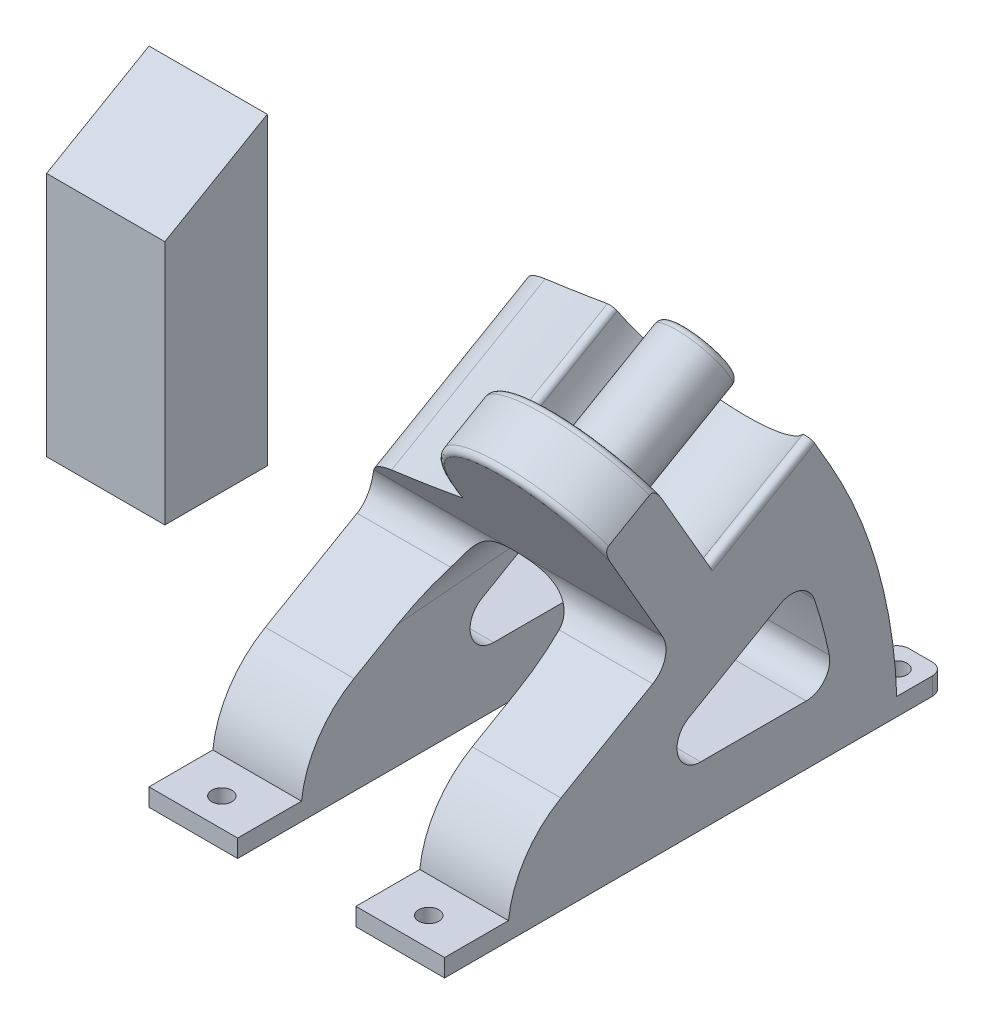
from build123d import *
from build123d.topology import SkipClean

# Parameters (mm, degrees)
AUFSATZ_LINEAR_AUSTRAGEN1_DEPTH   = 20
AUFSATZ_LINEAR_AUSTRAGEN2_DEPTH   = 30
AUFSATZ_LINEAR_AUSTRAGEN2_2_DEPTH = 30
AUFSATZ_LINEAR_AUSTRAGEN3_DEPTH   = 50
SCHNITT_LINEAR_AUSTRAGEN1_DEPTH   = 153.950505813
AUFSATZ_LINEAR_AUSTRAGEN5_DEPTH   = 50
SKIZZE12_W                        = 20
SKIZZE12_H                        = 35
SCHNITT_LINEAR_AUSTRAGEN4_DEPTH   = 155.203355684
VERRUNDUNG5_R                     = 10
VERRUNDUNG6_R                     = 10
SKIZZE13_R                        = 1.7
AUFSATZ_LINEAR_AUSTRAGEN9_DEPTH   = 3
VERRUNDUNG7_R                     = 2
SKIZZE14_W                        = 15
SKIZZE14_H                        = 19.74
SCHNITT_LINEAR_AUSTRAGEN5_DEPTH   = 145.895379972
VERRUNDUNG9_R                     = 18
SKIZZE30_W                        = 15
SKIZZE30_H                        = 5
AUFSATZ_LINEAR_AUSTRAGEN15_DEPTH  = 3
SKIZZE15_R                        = 1.7
SCHNITT_LINEAR_AUSTRAGEN6_DEPTH   = 145.895379972
SKIZZE18_W                        = 120
SKIZZE18_H                        = 10.2
SCHNITT_LINEAR_AUSTRAGEN8_DEPTH   = 10
VERRUNDUNG12_R                    = 18
VERRUNDUNG13_R                    = 2
SKIZZE16_R                        = 102.012355423
SCHNITT_LINEAR_AUSTRAGEN7_DEPTH   = 179.296805026
SKIZZE22_R                        = 1.5
SCHNITT_LINEAR_AUSTRAGEN13_DEPTH  = 10
SCHNITT_LINEAR_AUSTRAGEN14_DEPTH  = 20
AUFSATZ_LINEAR_AUSTRAGEN13_DEPTH  = 10
SKIZZE26_R                        = 5.9
AUFSATZ_LINEAR_AUSTRAGEN14_DEPTH  = 20
VERRUNDUNG14_R                    = 4.5
VERRUNDUNG15_R                    = 1
SCHNITT_LINEAR_AUSTRAGEN15_DEPTH  = 144.666423876
VERRUNDUNG16_R                    = 4
VERRUNDUNG17_R                    = 8.8
VERRUNDUNG18_R                    = 1
VERRUNDUNG19_R                    = 1
VERRUNDUNG20_R                    = 2
SCHNITT_LINEAR_AUSTRAGEN16_DEPTH  = 10


# Some blends are built 0.0001 mm under size
with BuildPart() as part:
    # Skizze1 → Aufsatz-Linear austragen1 (new body)
    with BuildSketch(Plane(origin=(0, 0, 0), x_dir=(0, 0, -1), z_dir=(1, 0, 0))):
        Polygon((0, 0), (0, 51.5), (-17.320508076, 41.5), (-17.320508076, 0), align=None)
    extrude(amount=AUFSATZ_LINEAR_AUSTRAGEN1_DEPTH)


with BuildPart() as body_2:
    # Skizze2 → Aufsatz-Linear austragen2 (new body)
    with BuildSketch(Plane(origin=(0, 12.875, -22.300154147), x_dir=(-1, 0, 0), z_dir=(0, 0.49999999999999506, -0.8660254037844415))):
        with BuildLine():
            Line((90, 62.898373783), (90, 34.475308295))
            Line((90, 34.475308295), (40, 34.475308295))
            Line((40, 34.475308295), (40, 41.167716793))
            ThreePointArc((40, 41.167716793), (65.782949027, 50.231560345), (90, 62.898373783))
        make_face()
    extrude(amount=-AUFSATZ_LINEAR_AUSTRAGEN2_DEPTH)

    # Skizze4 → Aufsatz-Linear austragen3 (add)
    with BuildSketch(Plane.ZY.offset(90)):
        with BuildLine():
            ThreePointArc((-5.0625, 42.731492787), (-13.600288367, 22.119448318), (-16.512368984, 0))
            Line((-16.512368984, 0), (68.95061659, 0))
            Line((68.95061659, 0), (20.918262114, 27.731492787))
            Line((20.918262114, 27.731492787), (-5.0625, 42.731492787))
        make_face()
    extrude(amount=-AUFSATZ_LINEAR_AUSTRAGEN3_DEPTH)


with BuildPart() as body_3:
    # Skizze2 → Aufsatz-Linear austragen2 2 (new body)
    with BuildSketch(Plane(origin=(0, 12.875, -22.300154147), x_dir=(-1, 0, 0), z_dir=(0, 0.49999999999999506, -0.8660254037844415))):
        with BuildLine():
            Line((-110, 62.898373783), (-110, 34.475308295))
            Line((-110, 34.475308295), (-60, 34.475308295))
            Line((-60, 34.475308295), (-60, 41.167716793))
            ThreePointArc((-60, 41.167716793), (-85.782949027, 50.231560345), (-110, 62.898373783))
        make_face()
    extrude(amount=-AUFSATZ_LINEAR_AUSTRAGEN2_2_DEPTH)

    # Skizze5 → Schnitt-Linear austragen1 (cut, through all)
    with BuildSketch(Plane(origin=(0, 12.875, -22.300154147), x_dir=(1, 0, 0), z_dir=(0, 0.4999999999999943, -0.866025403784442))):
        with BuildLine():
            ThreePointArc((110, -62.898373783), (93.944642376, -67.495844191), (88.842783939, -51.5935713))
            ThreePointArc((88.842783939, -51.5935713), (105.255078401, -46.328084817), (110, -62.898373783))
        make_face()
    extrude(amount=-SCHNITT_LINEAR_AUSTRAGEN1_DEPTH, mode=Mode.SUBTRACT)

    # Skizze7 → Aufsatz-Linear austragen5 (add)
    with BuildSketch(Plane(origin=(60, 0, 0), x_dir=(0, 0, -1), z_dir=(1, 0, 0))):
        with BuildLine():
            Line((5.0625, 42.731492787), (-68.95061659, 0))
            Line((-68.95061659, 0), (16.512368984, 0))
            ThreePointArc((16.512368984, 0), (13.600288367, 22.119448318), (5.0625, 42.731492787))
        make_face()
    extrude(amount=AUFSATZ_LINEAR_AUSTRAGEN5_DEPTH)


with BuildPart() as schnitt_linear_austragen4_tool:
    # Skizze12 → Schnitt-Linear austragen4 (new, through all)
    with BuildSketch(Plane(origin=(0, 1.462015525, -16.71091392), x_dir=(-1, 0, 0), z_dir=(0, 0.08715574274766162, -0.9961946980917453))):
        with Locations((65, 16.060852217)):
            Rectangle(SKIZZE12_W, SKIZZE12_H)
        with Locations((-85, 16.060852217)):
            Rectangle(SKIZZE12_W, SKIZZE12_H)
    extrude(amount=-SCHNITT_LINEAR_AUSTRAGEN4_DEPTH)


with BuildPart() as body_2_1:
    add(body_2.part)

    # Schnitt-Linear austragen4: cut by schnitt_linear_austragen4_tool
    add(schnitt_linear_austragen4_tool.part, mode=Mode.SUBTRACT)

    # Verrundung6
    verrundung6_edges = [body_2_1.edges().sort_by_distance(p)[0] for p in [
        (-55, 33.07898214, 6.973098632),
        (-75, 33.07898214, 6.973098632),
    ]]
    fillet(verrundung6_edges, radius=VERRUNDUNG6_R - 0.0001)  # a hair under: the kernel refuses the full size



with BuildPart() as body_3_1:
    add(body_3.part)

    # Schnitt-Linear austragen4: cut by schnitt_linear_austragen4_tool
    add(schnitt_linear_austragen4_tool.part, mode=Mode.SUBTRACT)

    # Verrundung5
    verrundung5_edges = [body_3_1.edges().sort_by_distance(p)[0] for p in [
        (75, 33.07898214, 6.973098632),
        (95, 33.07898214, 6.973098632),
    ]]
    fillet(verrundung5_edges, radius=VERRUNDUNG5_R - 0.0001)  # a hair under: the kernel refuses the full size


with BuildPart() as body_2_2:
    add(body_2_1.part)

    add(body_3_1.part)  # Aufsatz-Linear austragen9 merges body 3
    # Skizze13 → Aufsatz-Linear austragen9 (add)
    # profile 1 of 4: a face of its own
    with BuildSketch(Plane(origin=(0, 0, 0), x_dir=(1, 0, 0), z_dir=(0, 1, 0))):
        Polygon((-40, 16.512368984), (-40, 24.512368984), (-48, 24.512368984), (-48, 16.512368984), (-48, 14.788203179), (-40, 14.788203179), align=None)
        with Locations(Location((-44, 20.512368984, 0), (0, 0, 270))):
            Circle(SKIZZE13_R, mode=Mode.SUBTRACT)
    # profile 2 of 4: a face of its own
    with BuildSketch(Plane(origin=(0, 0, 0), x_dir=(1, 0, 0), z_dir=(0, 1, 0))):
        Polygon((-90, 24.512368984), (-82, 24.512368984), (-82, 16.512368984), (-82, 14.788203179), (-90, 14.788203179), (-90, 16.512368984), align=None)
        with Locations(Location((-86, 20.512368984, 0), (0, 0, 90))):
            Circle(SKIZZE13_R, mode=Mode.SUBTRACT)
    # profile 3 of 4: a face of its own
    with BuildSketch(Plane(origin=(0, 0, 0), x_dir=(1, 0, 0), z_dir=(0, 1, 0))):
        Polygon((68, 14.788203179), (68, 16.512368984), (68, 24.512368984), (60, 24.512368984), (60, 16.512368984), (60, 14.788203179), align=None)
        with Locations(Location((64, 20.512368984, 0), (0, 0, 90))):
            Circle(SKIZZE13_R, mode=Mode.SUBTRACT)
    # profile 4 of 4: a face of its own
    with BuildSketch(Plane(origin=(0, 0, 0), x_dir=(1, 0, 0), z_dir=(0, 1, 0))):
        Polygon((110, 14.788203179), (102, 14.788203179), (102, 16.512368984), (102, 24.512368984), (110, 24.512368984), (110, 16.512368984), align=None)
        with Locations(Location((106, 20.512368984, 0), (0, 0, 270))):
            Circle(SKIZZE13_R, mode=Mode.SUBTRACT)
    extrude(amount=AUFSATZ_LINEAR_AUSTRAGEN9_DEPTH)

    # Verrundung7
    verrundung7_edges = [body_2_2.edges().sort_by_distance(p)[0] for p in [
        (-90, 1.5, -24.512368984),
        (-82, 1.5, -24.512368984),
        (-40, 1.5, -24.512368984),
        (-48, 1.5, -24.512368984),
    ]]
    fillet(verrundung7_edges, radius=VERRUNDUNG7_R)

    # Skizze14 → Schnitt-Linear austragen5 (cut, through all)
    with BuildSketch(Plane(origin=(0, 3, 0), x_dir=(-1, 0, 0), z_dir=(0, -1, 0))):
        with Locations((82.5, -59.08061659)):
            Rectangle(SKIZZE14_W, SKIZZE14_H)
        with Locations((47.5, -59.08061659)):
            Rectangle(SKIZZE14_W, SKIZZE14_H)
        with Locations((-67.5, -59.08061659)):
            Rectangle(SKIZZE14_W, SKIZZE14_H)
        with Locations((-102.5, -59.08061659)):
            Rectangle(SKIZZE14_W, SKIZZE14_H)
    extrude(amount=-SCHNITT_LINEAR_AUSTRAGEN5_DEPTH, mode=Mode.SUBTRACT)

    # Verrundung9
    # the kernel refuses this fillet: 18 mm, written as the material it takes off along each edge
    with BuildSketch(Plane(origin=(-80.638040186, 11.396894314, 49.21061659), x_dir=(0, 0.500000000000003, -0.8660254037844368), z_dir=(1, 0, 0))) as verrundung9_piece_1:
        with BuildLine():
            CenterArc((10.255216074, -18), VERRUNDUNG9_R, 90, 53.415745183)
            Line((-4.198447157, -7.271923789), (-4.487520422, -7.057362264))
            ThreePointArc((-4.487520422, -7.057362264), (-2.410992724, -3.455961894), (-0.311769145, 0.18))
            Line((-0.311769145, 0.18), (0, 0.36))
            Line((0, 0.36), (10.255216074, 0.36))
            Line((10.255216074, 0.36), (10.255216074, 0))
        make_face()
    extrude(amount=66.276080372, mode=Mode.SUBTRACT)
    with BuildSketch(Plane(origin=(-49.361959814, 11.396894314, 49.21061659), x_dir=(0, -1, 0), z_dir=(-1, 0, 0))) as verrundung9_piece_2:
        with BuildLine():
            CenterArc((10.460849231, -17.881277642), VERRUNDUNG9_R, 96.584254817, 53.415745183)
            Line((-5.127608037, -8.881277642), (-5.439377183, -8.701277642))
            Line((-5.439377183, -8.701277642), (-0.311769145, 0.18))
            Line((-0.311769145, 0.18), (0, 0.36))
            ThreePointArc((0, 0.36), (4.198447157, 0.36), (8.355615215, 0.357625553))
            Line((8.355615215, 0.357625553), (8.396894314, 0))
        make_face()
    extrude(amount=66.276080372, mode=Mode.SUBTRACT)

    # Skizze30 → Aufsatz-Linear austragen15 (add)
    with SkipClean():  # the faces are left unmerged after this step: merging them gives an invalid solid
        with BuildSketch(Plane(origin=(0, 3, 0), x_dir=(1, 0, 0), z_dir=(0, 1, 0))):
            with Locations((67.5, -66.254464167)):
                Rectangle(SKIZZE30_W, SKIZZE30_H)
            with Locations((102.5, -66.254464167)):
                Rectangle(SKIZZE30_W, SKIZZE30_H)
        extrude(amount=-AUFSATZ_LINEAR_AUSTRAGEN15_DEPTH)
    add(body_2_2.part.scale(1), mode=Mode.REPLACE)  # the faces are merged on a copy

    # Skizze15 → Schnitt-Linear austragen6 (cut, through all)
    with SkipClean():  # the faces are left unmerged after this step: merging them gives an invalid solid
        with BuildSketch(Plane(origin=(0, 3, 0), x_dir=(-1, 0, 0), z_dir=(0, -1, 0))):
            with Locations(Location((82.5, -55.19061659, 0), (0, 0, 180))):
                Circle(SKIZZE15_R)
            with Locations((47.5, -55.19061659)):
                Circle(SKIZZE15_R)
            with Locations((-102.5, -55.19061659)):
                Circle(SKIZZE15_R)
            with Locations(Location((-67.5, -55.19061659, 0), (0, 0, 180))):
                Circle(SKIZZE15_R)
        extrude(amount=SCHNITT_LINEAR_AUSTRAGEN6_DEPTH, mode=Mode.SUBTRACT)

    # Skizze18 → Schnitt-Linear austragen8 (cut)
    with SkipClean():  # the faces are left unmerged after this step: merging them gives an invalid solid
        with BuildSketch(Plane(origin=(0, 12.875, -22.300154147), x_dir=(1, 0, 0), z_dir=(0, 0.5000000000000003, -0.8660254037844386))):
            with Locations((10, -19.375308295)):
                Rectangle(SKIZZE18_W, SKIZZE18_H)
        extrude(amount=-SCHNITT_LINEAR_AUSTRAGEN8_DEPTH, mode=Mode.SUBTRACT)

    # Verrundung12
    # the kernel refuses this fillet: 18 mm, written as the material it takes off along each edge
    with BuildSketch(Plane(origin=(135.638040186, 11.396894314, 49.21061659), x_dir=(0, 0.4999999999999999, -0.8660254037844386), z_dir=(-1, 0, 0))) as verrundung12_piece_1:
        with BuildLine():
            CenterArc((10.255216074, 18), VERRUNDUNG12_R, 216.584254817, 53.415745183)
            Line((-4.198447157, 7.271923789), (-4.487520422, 7.057362264))
            ThreePointArc((-4.487520422, 7.057362264), (-2.410992724, 3.455961894), (-0.311769145, -0.18))
            Line((-0.311769145, -0.18), (0, -0.36))
            Line((0, -0.36), (10.255216074, -0.36))
            Line((10.255216074, -0.36), (10.255216074, 0))
        make_face()
    extrude(amount=66.276080372, mode=Mode.SUBTRACT)
    with BuildSketch(Plane(origin=(34.361959814, 11.396894314, 49.21061659), x_dir=(0, 0.5000000000000001, -0.8660254037844387), z_dir=(1, 0, 0))) as verrundung12_piece_2:
        with BuildLine():
            CenterArc((10.255216074, -18), VERRUNDUNG12_R, 90, 53.415745183)
            Line((-4.198447157, -7.271923789), (-4.487520422, -7.057362264))
            ThreePointArc((-4.487520422, -7.057362264), (-2.410992724, -3.455961894), (-0.311769145, 0.18))
            Line((-0.311769145, 0.18), (0, 0.36))
            Line((0, 0.36), (10.255216074, 0.36))
            Line((10.255216074, 0.36), (10.255216074, 0))
        make_face()
    extrude(amount=66.276080372, mode=Mode.SUBTRACT)

    # Verrundung13
    verrundung13_edges = [body_2_2.edges().sort_by_distance(p)[0] for p in [
        (-40, 41.027288559, 11.274085306),
    ]]
    fillet(verrundung13_edges, radius=VERRUNDUNG13_R)

    # Skizze16 → Schnitt-Linear austragen7 (cut, through all)
    with BuildSketch(Plane(origin=(-40, 0, 0), x_dir=(0, 0, -1), z_dir=(1, 0, 0))):
        with Locations((7.48825997, 22.250503314)):
            Circle(SKIZZE16_R)
    extrude(amount=-SCHNITT_LINEAR_AUSTRAGEN7_DEPTH, mode=Mode.SUBTRACT)

    # Skizze22 → Schnitt-Linear austragen13 (cut)
    with BuildSketch(Plane(origin=(0, 0.581123967, -16.544660343), x_dir=(-1, 0, 0), z_dir=(0, 0.03510291595681101, -0.9993837027345048))):
        with Locations(Location((-67.5, 6.420367699, 0), (0, 0, 90))):
            Circle(SKIZZE22_R)
    extrude(amount=-SCHNITT_LINEAR_AUSTRAGEN13_DEPTH, mode=Mode.SUBTRACT)

    # Skizze24 → Schnitt-Linear austragen14 (cut)
    with BuildSketch(Plane(origin=(0, 12.875, -22.300154147), x_dir=(1, 0, 0), z_dir=(0, 0.4999999999999943, -0.866025403784442))):
        with BuildLine():
            Line((110, -42.49625835), (114.877844509, -55.876563707))
            Line((114.877844509, -55.876563707), (84.455399923, -65.804108765))
            Line((84.455399923, -65.804108765), (80.026030675, -47.84095026))
            ThreePointArc((80.026030675, -47.84095026), (93.151215763, -34.72730586), (110, -42.49625835))
        make_face()
    extrude(amount=-SCHNITT_LINEAR_AUSTRAGEN14_DEPTH, mode=Mode.SUBTRACT)

    # Skizze27 → Aufsatz-Linear austragen13 (add)
    with BuildSketch(Plane(origin=(0, 2.875, -4.979646072), x_dir=(1, 0, 0), z_dir=(0, 0.4999999999999942, -0.866025403784442))):
        with BuildLine():
            Line((110, -58.911316332), (110, -54.735147877))
            Line((110, -54.735147877), (110, -43.005661549))
            Line((110, -43.005661549), (94.941184516, -37.028507009))
            Line((94.941184516, -37.028507009), (80.026030675, -47.84095026))
            ThreePointArc((80.026030675, -47.84095026), (90.377510341, -65.927162202), (110, -58.911316332))
        make_face()
    extrude(amount=-AUFSATZ_LINEAR_AUSTRAGEN13_DEPTH)

    # Skizze26 → Aufsatz-Linear austragen14 (add)
    with BuildSketch(Plane(origin=(0, 2.875, -4.979646072), x_dir=(1, 0, 0), z_dir=(0, 0.4999999999999942, -0.866025403784442))):
        with Locations(Location((96, -50.703787341, 0), (0, 0, 270))):
            Circle(SKIZZE26_R)
    extrude(amount=AUFSATZ_LINEAR_AUSTRAGEN14_DEPTH)

    # Verrundung14
    verrundung14_edges = [body_2_2.edges().sort_by_distance(p)[0] for p in [
        (68.458676516, 27.731492787, 20.918262114),
        (101.541323484, 27.731492787, 20.918262114),
    ]]
    fillet(verrundung14_edges, radius=VERRUNDUNG14_R)

    # Verrundung15
    verrundung15_edges = [body_2_2.edges().sort_by_distance(p)[0] for p in [
        (96, 51.676218023, 0.101739523),
    ]]
    fillet(verrundung15_edges, radius=VERRUNDUNG15_R)

    # Skizze28 → Schnitt-Linear austragen15 (cut, through all)
    with BuildSketch(Plane(origin=(110, 0, 0), x_dir=(0, 0, -1), z_dir=(1, 0, 0))):
        with BuildLine():
            Line((5.846857911, 10), (-31.630108514, 10))
            Line((-31.630108514, 10), (0.825896467, 28.738483212))
            ThreePointArc((0.825896467, 28.738483212), (3.941030104, 19.531257867), (5.846857911, 10))
        make_face()
    extrude(amount=-SCHNITT_LINEAR_AUSTRAGEN15_DEPTH, mode=Mode.SUBTRACT)

    # Verrundung16
    verrundung16_edges = [body_2_2.edges().sort_by_distance(p)[0] for p in [
        (102.5, 10, 31.630108514),
        (67.5, 10, 31.630108514),
        (102.5, 10, -5.846857911),
        (67.5, 10, -5.846857911),
        (101.83121837, 28.738483212, -0.825896467),
        (68.16878163, 28.738483212, -0.825896467),
    ]]
    fillet(verrundung16_edges, radius=VERRUNDUNG16_R)

    # Verrundung17
    verrundung17_edges = [body_2_2.edges().sort_by_distance(p)[0] for p in [
        (60, 41.027288559, 11.274085306),
    ]]
    fillet(verrundung17_edges, radius=VERRUNDUNG17_R)

    # Verrundung18
    verrundung18_edges = [body_2_2.edges().sort_by_distance(p)[0] for p in [
        (90.377510341, 59.969597266, 27.983935029),
        (90.377510341, 54.969597266, 36.644189067),
    ]]
    fillet(verrundung18_edges, radius=VERRUNDUNG18_R)

    # Verrundung19
    verrundung19_edges = [body_2_2.edges().sort_by_distance(p)[0] for p in [
        (80.026030675, 49.306478266, 10.28057502),
        (110, 44.677839297, 7.608229065),
    ]]
    fillet(verrundung19_edges, radius=VERRUNDUNG19_R)

    # Verrundung20
    verrundung20_edges = [body_2_2.edges().sort_by_distance(p)[0] for p in [
        (102, 1.5, -24.512368984),
        (110, 1.5, -24.512368984),
        (60, 1.556624327, 68.754464167),
        (75, 1.556624327, 68.754464167),
        (95, 1.556624327, 68.754464167),
        (110, 1.556624327, 68.754464167),
        (60, 1.5, -24.512368984),
        (68, 1.5, -24.512368984),
    ]]
    fillet(verrundung20_edges, radius=VERRUNDUNG20_R)

    # Skizze31 → Schnitt-Linear austragen16 (cut)
    with BuildSketch(Plane(origin=(0, 3, 0), x_dir=(1, 0, 0), z_dir=(0, 1, 0))):
        Polygon((60, -60.01061659), (110, -60.01061659), (122.465746822, -77.509002664), (79.997783568, -80.177146953), (48.424742824, -75.730239806), align=None)
    extrude(amount=-SCHNITT_LINEAR_AUSTRAGEN16_DEPTH, mode=Mode.SUBTRACT)


solid = Compound([part.part, body_2_2.part])
